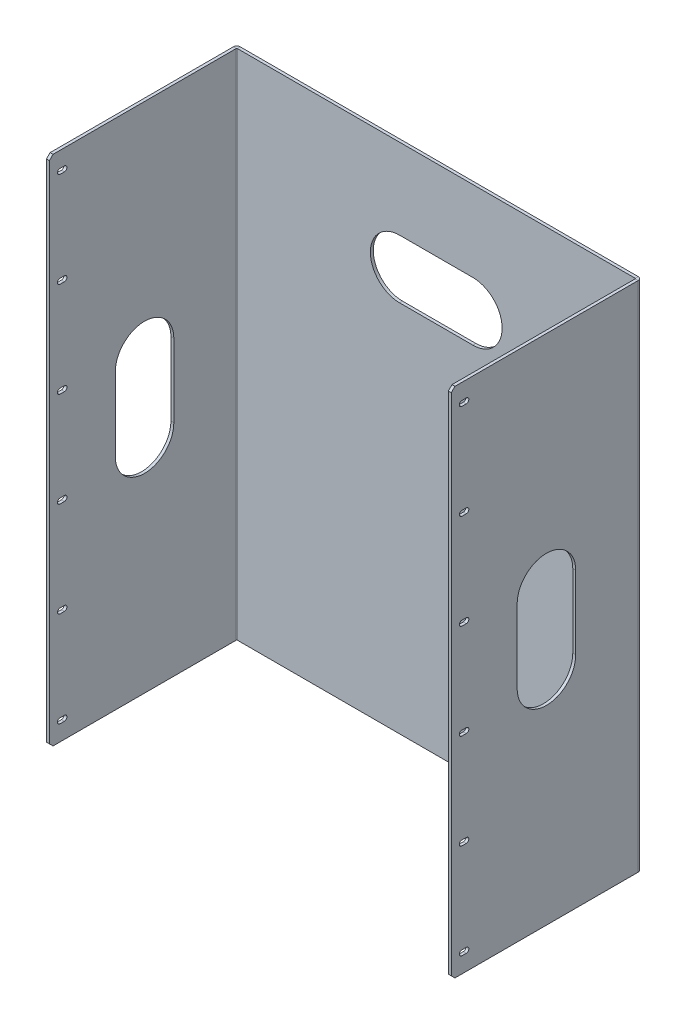
from build123d import *

# Parameters (mm, degrees)
SKETCH_1_W                         = 553
SKETCH_1_H                         = 700
SM_BASE_FLANGE_1_DEPTH             = 4
SM_EDGE_FLANGE_1_STRIP_W           = 17.4732
SM_EDGE_FLANGE_1_STRIP_H           = 4
SM_EDGE_FLANGE_1_STRIP_CUT_DEPTH   = 700
SM_EDGE_FLANGE_1_STRIP_2_W         = 17.4732
SM_EDGE_FLANGE_1_STRIP_2_H         = 4
SM_EDGE_FLANGE_1_STRIP_CUT_2_DEPTH = 700
SM_EDGE_FLANGE_1_DEPTH             = 700
SM_EDGE_FLANGE_1_BEND_DEPTH        = 700
CUT_EXTRUDE_1_DEPTH                = 703.741061843
CUT_EXTRUDE_2_DEPTH                = 10
CHAMFER_1_SIZE                     = 5
CUT_EXTRUDE_3_DEPTH                = 703.741061843
PATTERN_LINEAR_1_COUNT             = 6
PATTERN_LINEAR_1_PITCH             = 130


# Sheet-metal steps are written as plain solids
with BuildPart() as part:
    # Sketch 1 → 基体-法兰1 (new body)
    with BuildSketch(Plane.XY):
        Rectangle(SKETCH_1_W, SKETCH_1_H)
    extrude(amount=-SM_BASE_FLANGE_1_DEPTH)

    # 边线-法兰1 strip (across the edge) → 边线-法兰1 strip cut (cut)
    with BuildSketch(Plane(origin=(-276.5, 350, 0), x_dir=(1, 0, 0), z_dir=(0, -1, 0))):
        with Locations((-4, -2)):
            Rectangle(SM_EDGE_FLANGE_1_STRIP_W, SM_EDGE_FLANGE_1_STRIP_H)
    extrude(amount=SM_EDGE_FLANGE_1_STRIP_CUT_DEPTH, mode=Mode.SUBTRACT)

    # 边线-法兰1 strip 2 (across the edge) → 边线-法兰1 strip cut 2 (cut)
    with BuildSketch(Plane(origin=(276.5, -350, 0), x_dir=(-1, 0, 0), z_dir=(0, 1, 0))):
        with Locations((-4, -2)):
            Rectangle(SM_EDGE_FLANGE_1_STRIP_2_W, SM_EDGE_FLANGE_1_STRIP_2_H)
    extrude(amount=SM_EDGE_FLANGE_1_STRIP_CUT_2_DEPTH, mode=Mode.SUBTRACT)

    # 边线-法兰1 section (across the edge) → 边线-法兰1 (add)
    with BuildSketch(Plane(origin=(-276.5, 350, 0), x_dir=(1, 0, 0), z_dir=(0, -1, 0))):
        with BuildLine():
            Line((0, 0.7366), (0, 256))
            Line((0, 256), (4, 256))
            Line((4, 256), (4, 0.7366))
            ThreePointArc((4, 0.7366), (4.215745145, 0.215745145), (4.7366, 0))
            Line((4.7366, 0), (4.7366, -4))
            ThreePointArc((4.7366, -4), (1.38731802, -2.61268198), (0, 0.7366))
        make_face()
    extrude(amount=SM_EDGE_FLANGE_1_DEPTH)

    # 边线-法兰1 section 2 (across the edge) → 边线-法兰1 bend (add)
    with BuildSketch(Plane(origin=(276.5, -350, 0), x_dir=(-1, 0, 0), z_dir=(0, 1, 0))):
        with BuildLine():
            Line((0, 0.7366), (0, 256))
            Line((0, 256), (4, 256))
            Line((4, 256), (4, 0.7366))
            ThreePointArc((4, 0.7366), (4.215745145, 0.215745145), (4.7366, 0))
            Line((4.7366, 0), (4.7366, -4))
            ThreePointArc((4.7366, -4), (1.38731802, -2.61268198), (0, 0.7366))
        make_face()
    extrude(amount=SM_EDGE_FLANGE_1_BEND_DEPTH)

    # 草图15 → 切除-拉伸1 (cut, through all)
    with BuildSketch(Plane.ZY.offset(276.5)):
        with BuildLine():
            Line((166, 50), (166, -50))
            ThreePointArc((166, -50), (126, -90), (86, -50))
            Line((86, -50), (86, 50))
            ThreePointArc((86, 50), (126, 90), (166, 50))
        make_face()
    extrude(amount=-CUT_EXTRUDE_1_DEPTH, mode=Mode.SUBTRACT)

    # 草图16 → 切除-拉伸2 (cut)
    with BuildSketch(Plane.XY):
        with BuildLine():
            Line((-50, 240), (50, 240))
            ThreePointArc((50, 240), (90, 200), (50, 160))
            Line((50, 160), (-50, 160))
            ThreePointArc((-50, 160), (-90, 200), (-50, 240))
        make_face()
    extrude(amount=-CUT_EXTRUDE_2_DEPTH, mode=Mode.SUBTRACT)

    # 倒角1
    chamfer_1_edges = [part.edges().sort_by_distance(p)[0] for p in [
        (-274.5, 350, 256),
        (-274.5, -350, 256),
        (274.5, -350, 256),
        (274.5, 350, 256),
    ]]
    chamfer(chamfer_1_edges, length=CHAMFER_1_SIZE)

    # 草图17 → 切除-拉伸3 (cut, through all)
    with BuildSketch(Plane.ZY.offset(276.5)):
        with BuildLine():
            Line((235.5, 328.5), (241.5, 328.5))
            ThreePointArc((241.5, 328.5), (245, 325), (241.5, 321.5))
            Line((241.5, 321.5), (235.5, 321.5))
            ThreePointArc((235.5, 321.5), (232, 325), (235.5, 328.5))
        make_face()
    cut_extrude_3 = extrude(amount=-CUT_EXTRUDE_3_DEPTH, mode=Mode.SUBTRACT)

    # 阵列(线性)1: 切除-拉伸3 ×6
    with Locations(*[(0, -i * PATTERN_LINEAR_1_PITCH, 0) for i in range(1, PATTERN_LINEAR_1_COUNT)]):
        add(cut_extrude_3, mode=Mode.SUBTRACT)


solid = part.part
